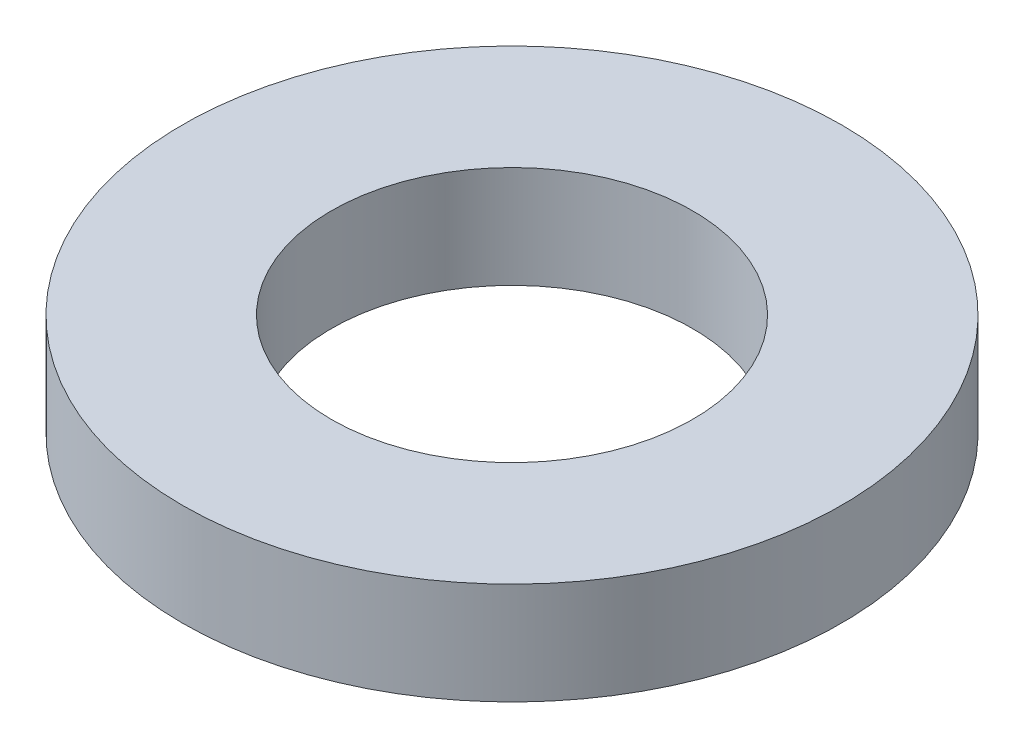
from build123d import *

# Parameters (mm, degrees)
SKETCH1_R           = 77.5
BOSS_EXTRUDE1_DEPTH = 24
SKETCH2_R           = 42.5
CUT_EXTRUDE1_DEPTH  = 113.198484838


with BuildPart() as part:
    # Sketch1 → Boss-Extrude1 (new body)
    with BuildSketch(Plane(origin=(0, 0, 0), x_dir=(1, 0, 0), z_dir=(0, 1, 0))):
        Circle(SKETCH1_R)
    extrude(amount=BOSS_EXTRUDE1_DEPTH)

    # Sketch2 → Cut-Extrude1 (cut, through all)
    with BuildSketch(Plane(origin=(0, 0, 0), x_dir=(1, 0, 0), z_dir=(0, 1, 0))):
        Circle(SKETCH2_R)
    extrude(amount=CUT_EXTRUDE1_DEPTH, mode=Mode.SUBTRACT)


solid = part.part
